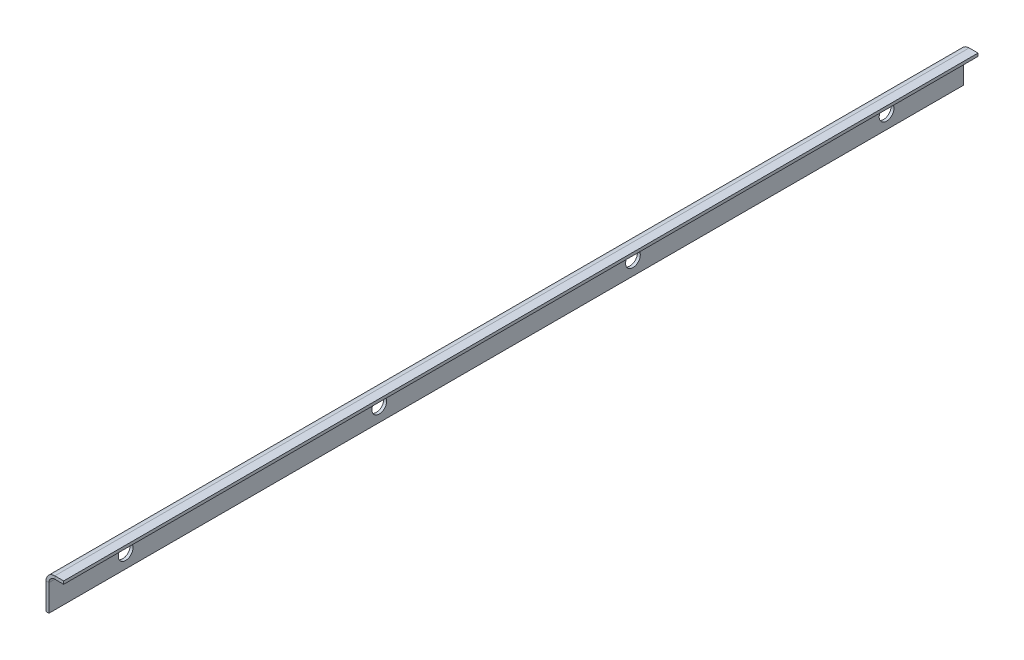
from build123d import *

# Parameters (mm, degrees)
BOSS_EXTRUDE1_DEPTH  = 310
SKETCH2_R            = 2.5
CUT_EXTRUDE1_DEPTH   = 311.25795719
CONVERT_SOLID2_DEPTH = 310


# Read off the part's stored shape, not the designer's step: Convert-Solid2
with BuildPart() as part:
    # Sketch1 → Boss-Extrude1 (new body)
    with BuildSketch(Plane.XY):
        Polygon((0, 0), (0, 10), (4, 10), (4, 12), (-2, 12), (-2, 0), align=None)
    extrude(amount=BOSS_EXTRUDE1_DEPTH)

    # Sketch2 → Cut-Extrude1 (cut, through all)
    with BuildSketch(Plane(origin=(0, 0, 0), x_dir=(0, 0, -1), z_dir=(1, 0, 0))):
        with Locations((-284, 5)):
            Circle(SKETCH2_R)
        with Locations((-198, 5)):
            Circle(SKETCH2_R)
        with Locations((-112, 5)):
            Circle(SKETCH2_R)
        with Locations((-26, 5)):
            Circle(SKETCH2_R)
    extrude(amount=-CUT_EXTRUDE1_DEPTH, mode=Mode.SUBTRACT)

    # Convert-Solid2 outline → Convert-Solid2 (cut)
    with BuildSketch(Plane.XY):
        with BuildLine():
            Line((-2, 12), (-2, 9))
            ThreePointArc((-2, 9), (-1.121320344, 11.121320344), (1, 12))
            Line((1, 12), (-2, 12))
        make_face()
        with BuildLine():
            Line((-1, 9), (-1, 0))
            Line((-1, 0), (0, 0))
            Line((0, 0), (0, 10))
            Line((0, 10), (4, 10))
            Line((4, 10), (4, 11))
            Line((4, 11), (1, 11))
            ThreePointArc((1, 11), (-0.414213562, 10.414213562), (-1, 9))
        make_face()
    extrude(amount=CONVERT_SOLID2_DEPTH, mode=Mode.SUBTRACT)


solid = part.part
